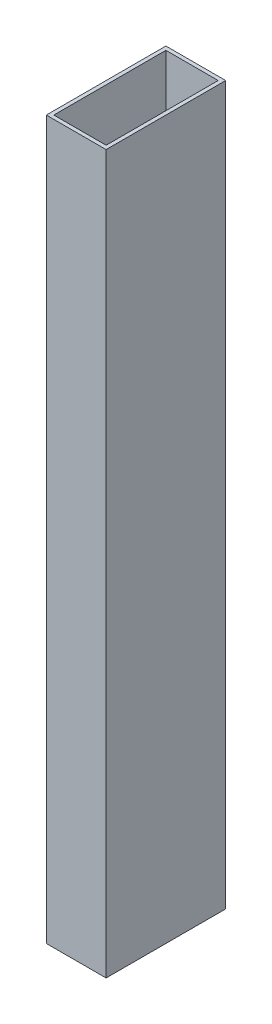
from build123d import *

# Parameters (mm, degrees)
SKETCH1_W           = 25.4
SKETCH1_H           = 50.8
SKETCH1_W_2         = 22.225
SKETCH1_H_2         = 47.625
EXTRUDE_THIN1_DEPTH = 304.8


with BuildPart() as part:
    # Sketch1 → Extrude-Thin1 (new body)
    with BuildSketch(Plane(origin=(0, 0, 0), x_dir=(1, 0, 0), z_dir=(0, 1, 0))):
        Rectangle(SKETCH1_W, SKETCH1_H)
        Rectangle(SKETCH1_W_2, SKETCH1_H_2, mode=Mode.SUBTRACT)
    extrude(amount=EXTRUDE_THIN1_DEPTH)


solid = part.part
